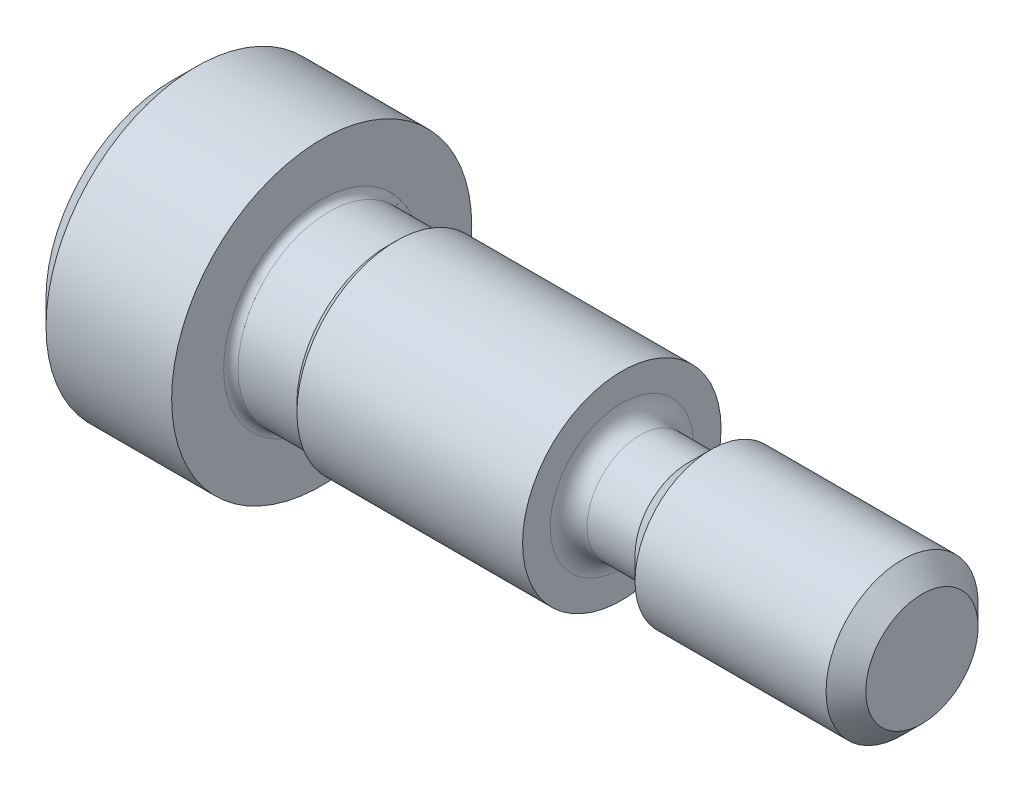
from build123d import *

# Parameters (mm, degrees)
HEX_2_DEPTH = 2.3876


# Read off the part's stored shape, not the designer's step: ThreadSchematic
with BuildPart() as part:
    # ThreadSchematic outline → ThreadSchematic (revolve)
    with BuildSketch(Plane.YX):
        with BuildLine():
            Line((0, 23.8252), (0, 0))
            Line((0, 0), (3.9751, 0))
            Line((3.9751, 0), (4.7625, 0.7874))
            Line((4.7625, 0.7874), (4.7625, 4.7752))
            Line((4.7625, 4.7752), (3.1115, 4.7752))
            ThreePointArc((3.1115, 4.7752), (2.94985539, 4.84215539), (2.8829, 5.0038))
            Line((2.8829, 5.0038), (2.8829, 6.8707))
            Line((2.8829, 6.8707), (3.1496, 7.1374))
            Line((3.1496, 7.1374), (3.1496, 14.3002))
            Line((3.1496, 14.3002), (2.2733, 14.3002))
            ThreePointArc((2.2733, 14.3002), (1.860208218, 14.471308218), (1.6891, 14.8844))
            Line((1.6891, 14.8844), (1.6891, 16.4084))
            Line((1.6891, 16.4084), (2.413, 17.1323))
            Line((2.413, 17.1323), (2.413, 23.19528))
            Line((2.413, 23.19528), (1.78308, 23.8252))
            Line((1.78308, 23.8252), (0, 23.8252))
        make_face()
    revolve(axis=Axis((0, 0, 0), (1, 0, 0)))

    # Sketch2 → PreBroach (revolve, cut)
    with BuildSketch(Plane.XY, mode=Mode.PRIVATE) as prebroach_sk:
        Polygon((0, 1.5875), (2.3876, 1.5875), (3.304143552, 0), (0, 0), align=None)
    revolve(prebroach_sk.sketch.rotate(Axis((0, 0, 0), (1, 0, 0)), 90), axis=Axis((0, 0, 0), (1, 0, 0)), mode=Mode.SUBTRACT)

    # Sketch3 → Hex 2 (cut)
    with BuildSketch(Plane.ZY):
        Polygon((-1.5875, -0.916543552), (-1.5875, 0.916543552), (0, 1.833087105), (1.5875, 0.916543552), (1.5875, -0.916543552), (0, -1.833087105), align=None)
    extrude(amount=-HEX_2_DEPTH, mode=Mode.SUBTRACT)


solid = part.part
